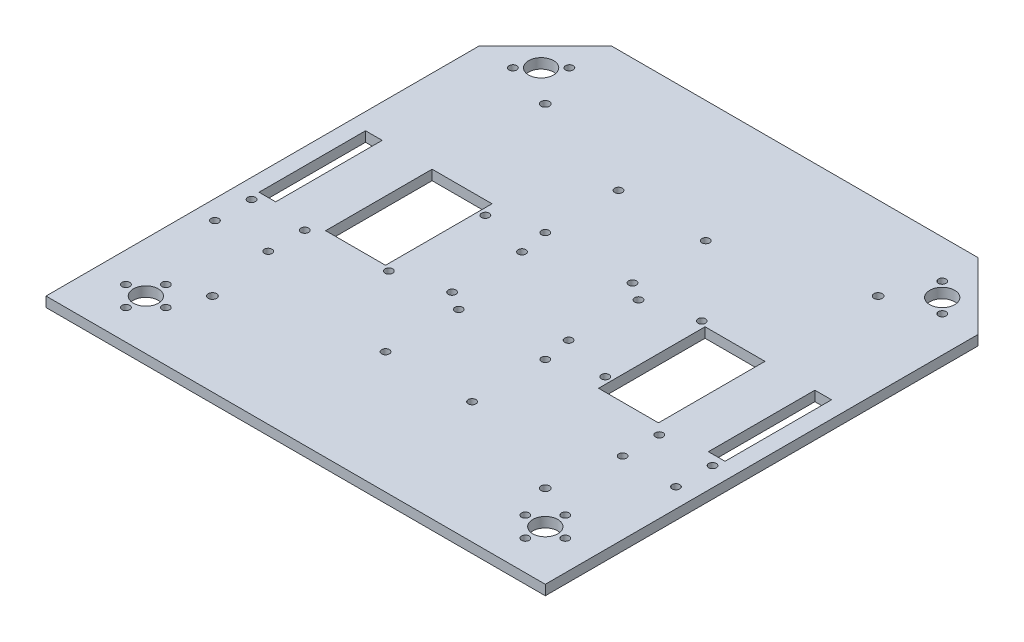
from build123d import *

# Parameters (mm, degrees)
ESQUISSE1_R              = 7.5
ESQUISSE1_R_2            = 2.3
BOSS_EXTRU_1_DEPTH       = 6
ENL_V_MAT_EXTRU_9_DEPTH  = 10.5
ESQUISSE6_R              = 2.3
ENL_V_MAT_EXTRU_10_DEPTH = 50
ENL_V_MAT_EXTRU_11_DEPTH = 50
ESQUISSE9_R              = 2.5
ENL_V_MAT_EXTRU_12_DEPTH = 35
ESQUISSE3_R              = 2.3
ENL_V_MAT_EXTRU_13_DEPTH = 35
ESQUISSE10_R             = 2.3
ENL_V_MAT_EXTRU_14_DEPTH = 10


with BuildPart() as part:
    # Esquisse1 → Boss.-Extru.1 (new body)
    with BuildSketch(Plane(origin=(0, 0, 0), x_dir=(1, 0, 0), z_dir=(0, 1, 0))):
        Polygon((-150, 0), (-150, 260), (-110, 300), (110, 300), (150, 260), (150, 0), align=None)
        with Locations((-120, 30)):
            Circle(ESQUISSE1_R, mode=Mode.SUBTRACT)
        with Locations((-120, 267.5)):
            Circle(ESQUISSE1_R, mode=Mode.SUBTRACT)
        with Locations((120, 268.5)):
            Circle(ESQUISSE1_R, mode=Mode.SUBTRACT)
        with Locations((-111.514718626, 275.985281374)):
            Circle(ESQUISSE1_R_2, mode=Mode.SUBTRACT)
        with Locations((-128.485281374, 259.014718626)):
            Circle(ESQUISSE1_R_2, mode=Mode.SUBTRACT)
        with Locations((111.514718626, 276.985281374)):
            Circle(ESQUISSE1_R_2, mode=Mode.SUBTRACT)
        with Locations((128.485281374, 260.014718626)):
            Circle(ESQUISSE1_R_2, mode=Mode.SUBTRACT)
        with Locations((120, 30)):
            Circle(ESQUISSE1_R, mode=Mode.SUBTRACT)
        with Locations((120, 42)):
            Circle(ESQUISSE1_R_2, mode=Mode.SUBTRACT)
        with Locations((-120, 42)):
            Circle(ESQUISSE1_R_2, mode=Mode.SUBTRACT)
        with Locations((-120, 18)):
            Circle(ESQUISSE1_R_2, mode=Mode.SUBTRACT)
        with Locations((-132, 30)):
            Circle(ESQUISSE1_R_2, mode=Mode.SUBTRACT)
        with Locations((-108, 30)):
            Circle(ESQUISSE1_R_2, mode=Mode.SUBTRACT)
        with Locations((108, 30)):
            Circle(ESQUISSE1_R_2, mode=Mode.SUBTRACT)
        with Locations((132, 30)):
            Circle(ESQUISSE1_R_2, mode=Mode.SUBTRACT)
        with Locations((120, 18)):
            Circle(ESQUISSE1_R_2, mode=Mode.SUBTRACT)
    extrude(amount=BOSS_EXTRU_1_DEPTH)

    # Esquisse7 → Enlèv. mat.-Extru.9 (cut)
    with BuildSketch(Plane(origin=(0, 6, 0), x_dir=(1, 0, 0), z_dir=(0, 1, 0))):
        Polygon((-130, 150), (-130, 182), (-140, 182), (-140, 118), (-130, 118), align=None)
    enl_v_mat_extru_9 = extrude(amount=-ENL_V_MAT_EXTRU_9_DEPTH, mode=Mode.SUBTRACT)

    # Esquisse6 → Enlèv. mat.-Extru.10 (cut)
    with BuildSketch(Plane(origin=(0, 6, 0), x_dir=(1, 0, 0), z_dir=(0, 1, 0))):
        with Locations((-138.5, 90)):
            Circle(ESQUISSE6_R)
        with Locations((-138.5, 112)):
            Circle(ESQUISSE6_R)
        with Locations((-106.5, 112)):
            Circle(ESQUISSE6_R)
        with Locations((-106.5, 90)):
            Circle(ESQUISSE6_R)
    enl_v_mat_extru_10 = extrude(amount=-ENL_V_MAT_EXTRU_10_DEPTH, mode=Mode.SUBTRACT)

    # Esquisse4 → Enlèv. mat.-Extru.11 (cut)
    with BuildSketch(Plane(origin=(0, 6, 0), x_dir=(1, 0, 0), z_dir=(0, 1, 0))):
        Polygon((-100, 150), (-100, 182), (-64, 182), (-64, 118), (-100, 118), align=None)
    enl_v_mat_extru_11 = extrude(amount=-ENL_V_MAT_EXTRU_11_DEPTH, mode=Mode.SUBTRACT)

    # Symétrie1: Enlèv. mat.-Extru.9 across plane
    add(enl_v_mat_extru_9.mirror(Plane(origin=(0, 0, 0), x_dir=(0, 0, 1), z_dir=(1, 0, 0))), mode=Mode.SUBTRACT)

    # Symétrie2: Enlèv. mat.-Extru.11 across plane
    add(enl_v_mat_extru_11.mirror(Plane(origin=(0, 0, 0), x_dir=(0, 0, 1), z_dir=(1, 0, 0))), mode=Mode.SUBTRACT)

    # Symétrie3: Enlèv. mat.-Extru.10 across plane
    add(enl_v_mat_extru_10.mirror(Plane(origin=(0, 0, 0), x_dir=(0, 0, 1), z_dir=(1, 0, 0))), mode=Mode.SUBTRACT)

    # Esquisse9 → Enlèv. mat.-Extru.12 (cut)
    with BuildSketch(Plane(origin=(0, 6, 0), x_dir=(1, 0, 0), z_dir=(0, 1, 0))):
        with Locations((-100, 50)):
            Circle(ESQUISSE9_R)
        with Locations((100, 50)):
            Circle(ESQUISSE9_R)
        with Locations((100, 250)):
            Circle(ESQUISSE9_R)
        with Locations((-100, 250)):
            Circle(ESQUISSE9_R)
    extrude(amount=-ENL_V_MAT_EXTRU_12_DEPTH, mode=Mode.SUBTRACT)

    # Esquisse3 → Enlèv. mat.-Extru.13 (cut)
    with BuildSketch(Plane(origin=(0, 6, 0), x_dir=(1, 0, 0), z_dir=(0, 1, 0))):
        with Locations((-60, 174)):
            Circle(ESQUISSE3_R)
        with Locations((-60, 116)):
            Circle(ESQUISSE3_R)
        with Locations((-30, 166)):
            Circle(ESQUISSE3_R)
        with Locations((-30, 124)):
            Circle(ESQUISSE3_R)
        with Locations((60, 184)):
            Circle(ESQUISSE3_R)
        with Locations((30, 176)):
            Circle(ESQUISSE3_R)
        with Locations((30, 134)):
            Circle(ESQUISSE3_R)
        with Locations((60, 126)):
            Circle(ESQUISSE3_R)
    extrude(amount=-ENL_V_MAT_EXTRU_13_DEPTH, mode=Mode.SUBTRACT)

    # Esquisse10 → Enlèv. mat.-Extru.14 (cut)
    with BuildSketch(Plane(origin=(0, 6, 0), x_dir=(1, 0, 0), z_dir=(0, 1, 0))):
        with Locations((-33, 227)):
            Circle(ESQUISSE10_R)
        with Locations((-19, 73)):
            Circle(ESQUISSE10_R)
        with Locations((33, 73)):
            Circle(ESQUISSE10_R)
        with Locations((-33, 183)):
            Circle(ESQUISSE10_R)
        with Locations((33, 117)):
            Circle(ESQUISSE10_R)
        with Locations((-19, 117)):
            Circle(ESQUISSE10_R)
        with Locations((19.4, 227)):
            Circle(ESQUISSE10_R)
        with Locations((19.4, 183)):
            Circle(ESQUISSE10_R)
    extrude(amount=-ENL_V_MAT_EXTRU_14_DEPTH, mode=Mode.SUBTRACT)


solid = part.part
